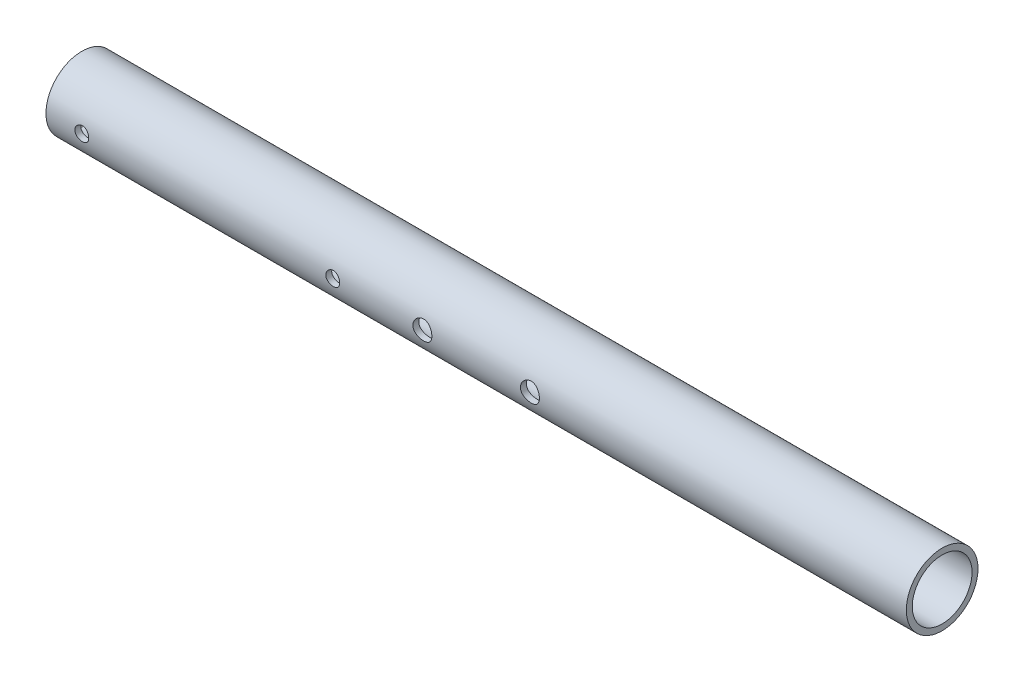
from build123d import *

# Parameters (mm, degrees)
SKETCH1_R               = 12.7
SKETCH1_R_2             = 10.5918
BOSS_EXTRUDE1_DEPTH     = 304.8
CUT_EXTRUDE1_DEPTH      = 306.328708116
CUT_EXTRUDE1_DEPTH_BACK = 306.328708116
SKETCH8_R               = 2.4638
SKETCH8_R_2             = 3.3655


with BuildPart() as part:
    # Sketch1 → Boss-Extrude1 (new body)
    with BuildSketch(Plane(origin=(0, 0, 0), x_dir=(0, 0, -1), z_dir=(1, 0, 0))):
        Circle(SKETCH1_R)
        Circle(SKETCH1_R_2, mode=Mode.SUBTRACT)
    extrude(amount=BOSS_EXTRUDE1_DEPTH)

    # Sketch8 → Cut-Extrude1 (cut, two sides: drawn at the far end of the back side and taken through both)
    with BuildSketch(Plane.XY.offset(-CUT_EXTRUDE1_DEPTH_BACK)):
        with Locations((12.7, 0)):
            Circle(SKETCH8_R)
        with Locations((101.6, 0)):
            Circle(SKETCH8_R)
        with Locations((133.35, 0)):
            Circle(SKETCH8_R_2)
        with Locations((171.45, 0)):
            Circle(SKETCH8_R_2)
    extrude(amount=CUT_EXTRUDE1_DEPTH + CUT_EXTRUDE1_DEPTH_BACK, mode=Mode.SUBTRACT)


solid = part.part
